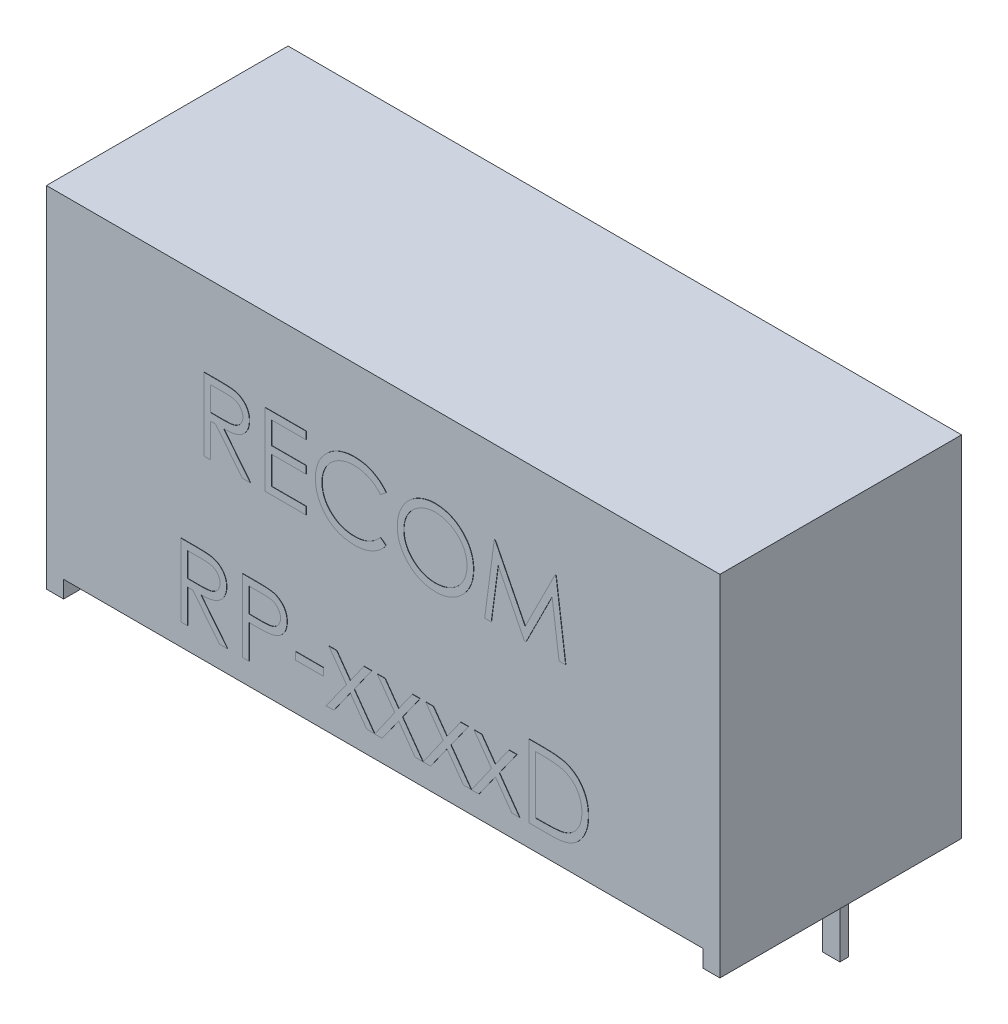
from build123d import *

# Parameters (mm, degrees)
CROQUIS1_W                  = 0.5
CROQUIS1_H                  = 7.05
SALIENTE_EXTRUIR1_DEPTH     = 0.5
SALIENTE_EXTRUIR1_2_DEPTH   = 0.5
CROQUIS2_W                  = 19.65
CROQUIS2_H                  = 7.05
SALIENTE_EXTRUIR2_DEPTH     = 9.7
CROQUIS3_W                  = 0.51
CROQUIS3_H                  = 0.25
SALIENTE_EXTRUIR3_DEPTH     = 4
SALIENTE_EXTRUIR4_OUTLINE_W = 0.814102564
SALIENTE_EXTRUIR4_OUTLINE_H = 0.217094017
SALIENTE_EXTRUIR4_DEPTH     = 0.01


# Read off the part's stored shape, not the designer's step: Saliente-Extruir4
with BuildPart() as part:
    # Croquis1 → Saliente-Extruir1 (new body)
    with BuildSketch(Plane(origin=(0, 0, 0), x_dir=(1, 0, 0), z_dir=(0, 1, 0))):
        with Locations((-9.575, 0)):
            Rectangle(CROQUIS1_W, CROQUIS1_H)
    extrude(amount=SALIENTE_EXTRUIR1_DEPTH)



with BuildPart() as body_2:
    # Croquis1 → Saliente-Extruir1 2 (new body)
    with BuildSketch(Plane(origin=(0, 0, 0), x_dir=(1, 0, 0), z_dir=(0, 1, 0))):
        with Locations((9.575, 0)):
            Rectangle(CROQUIS1_W, CROQUIS1_H)
    extrude(amount=SALIENTE_EXTRUIR1_2_DEPTH)


with BuildPart() as part_1:
    add(part.part)

    add(body_2.part)  # Saliente-Extruir2 merges body 2
    # Croquis2 → Saliente-Extruir2 (add)
    with BuildSketch(Plane(origin=(0, 0.5, 0), x_dir=(1, 0, 0), z_dir=(0, 1, 0))):
        Rectangle(CROQUIS2_W, CROQUIS2_H)
    extrude(amount=SALIENTE_EXTRUIR2_DEPTH)

    # Croquis3 → Saliente-Extruir3 (add)
    with BuildSketch(Plane.XZ.offset(-0.5)):
        with Locations((-7.825, -2.255)):
            Rectangle(CROQUIS3_W, CROQUIS3_H)
        with Locations((-5.285, -2.255)):
            Rectangle(CROQUIS3_W, CROQUIS3_H)
        with Locations((2.335, -2.255)):
            Rectangle(CROQUIS3_W, CROQUIS3_H)
        with Locations((4.875, -2.255)):
            Rectangle(CROQUIS3_W, CROQUIS3_H)
        with Locations((7.415, -2.255)):
            Rectangle(CROQUIS3_W, CROQUIS3_H)
    extrude(amount=SALIENTE_EXTRUIR3_DEPTH)

    # Saliente-Extruir4 outline → Saliente-Extruir4 (add)
    # profile 1 of 13: a face of its own
    with BuildSketch(Plane.XY.offset(3.525)):
        with BuildLine():
            add(Edge.make_bspline(
                [(-3.894123932, 7.2228332), (-3.895012326, 7.194630065), (-3.896745813, 7.139598445), (-3.912908137, 7.059733054), (-3.939382509, 6.98523285), (-3.975863736, 6.916191635), (-4.022321228, 6.853955197), (-4.078155745, 6.799290494), (-4.143398434, 6.753546356), (-4.204134258, 6.721824898), (-4.257785227, 6.701509186), (-4.301952992, 6.687214817), (-4.350132545, 6.676170676), (-4.401862266, 6.666276692), (-4.457357429, 6.658806857), (-4.516485025, 6.653335822), (-4.579287221, 6.649916469), (-4.622430373, 6.649407256), (-4.644624733, 6.649145299)],
                knots=[0, 0, 0, 0, 0.078780236, 0.153720644, 0.22671353, 0.299191166, 0.371189997, 0.443006414, 0.516689173, 0.593217217, 0.633872918, 0.676989142, 0.722899506, 0.771958611, 0.824211323, 0.879378651, 0.937948119, 1, 1, 1, 1], degree=3))
            add(Edge.make_bspline(
                [(-4.320679754, 7.76005609), (-4.305193843, 7.756229903), (-4.274552378, 7.748659153), (-4.230434958, 7.732657394), (-4.188395343, 7.714139812), (-4.148608163, 7.692390324), (-4.111272708, 7.667247481), (-4.076004016, 7.63914533), (-4.042642045, 7.608237639), (-4.012536012, 7.57374514), (-3.984149061, 7.537558298), (-3.960207368, 7.498427931), (-3.939568973, 7.457508817), (-3.92313728, 7.414384807), (-3.909906315, 7.369474116), (-3.900577113, 7.322369939), (-3.894982347, 7.273286873), (-3.894412749, 7.239808519), (-3.894123932, 7.2228332)],
                knots=[0, 0, 0, 0, 0.064216843, 0.127063766, 0.188744538, 0.249132103, 0.309452533, 0.369826676, 0.430650142, 0.492351932, 0.554072106, 0.615689784, 0.676797703, 0.738439048, 0.80131691, 0.865184512, 0.931641324, 1, 1, 1, 1], degree=3))
            add(Edge.make_bspline(
                [(-4.800237046, 7.788888889), (-4.771969792, 7.788794796), (-4.717693533, 7.788614128), (-4.639937317, 7.787606738), (-4.56928474, 7.78471939), (-4.505772742, 7.782234675), (-4.449402488, 7.777703835), (-4.400001127, 7.773373348), (-4.357796186, 7.767704515), (-4.332247504, 7.762439807), (-4.320679754, 7.76005609)],
                knots=[0, 0, 0, 0, 0.176257755, 0.338434414, 0.484822051, 0.617157578, 0.734698361, 0.837385184, 0.926372421, 1, 1, 1, 1], degree=3))
            Line((-4.800237046, 7.788888889), (-5.223824786, 7.788888889))
            Line((-5.223824786, 7.788888889), (-5.223824786, 5.672222222))
            Line((-5.223824786, 5.672222222), (-5.033867521, 5.672222222))
            Line((-5.033867521, 5.672222222), (-5.033867521, 6.649145299))
            Line((-5.033867521, 6.649145299), (-4.879527244, 6.649145299))
            Line((-4.879527244, 6.649145299), (-4.10188969, 5.672222222))
            Line((-4.10188969, 5.672222222), (-3.866987179, 5.672222222))
            Line((-3.866987179, 5.672222222), (-4.644624733, 6.649145299))
        make_face()
        with BuildLine():
            add(Edge.make_bspline(
                [(-4.64632078, 6.863271234), (-4.62822628, 6.863263229), (-4.593153986, 6.863247713), (-4.54241406, 6.865662997), (-4.495169993, 6.868410622), (-4.45160249, 6.872613322), (-4.41169209, 6.878029613), (-4.37545874, 6.884804751), (-4.342843294, 6.892698141), (-4.304804654, 6.904915315), (-4.262328276, 6.924271336), (-4.216165917, 6.952432375), (-4.176854979, 6.987852747), (-4.143642748, 7.028355742), (-4.116954949, 7.07288814), (-4.098139564, 7.120916135), (-4.086200087, 7.171227244), (-4.084791871, 7.205806386), (-4.084081197, 7.223257212)],
                knots=[0, 0, 0, 0, 0.07166815, 0.138913286, 0.20118457, 0.259124428, 0.312255041, 0.36068151, 0.405086143, 0.445101659, 0.51877778, 0.589461579, 0.658462242, 0.727283218, 0.796322487, 0.863174893, 0.930949381, 1, 1, 1, 1], degree=3))
            Line((-4.64632078, 6.863271234), (-5.033867521, 6.866239316))
            Line((-5.033867521, 6.866239316), (-5.033867521, 7.571794872))
            Line((-5.033867521, 7.571794872), (-4.636992521, 7.571794872))
            add(Edge.make_bspline(
                [(-4.084081197, 7.223257212), (-4.084808194, 7.240279187), (-4.086248836, 7.274010531), (-4.098010711, 7.323392915), (-4.117900956, 7.370000071), (-4.144705357, 7.413642402), (-4.177361989, 7.453257776), (-4.21565419, 7.487152959), (-4.25853495, 7.515122873), (-4.298613247, 7.532996237), (-4.334435842, 7.543954434), (-4.365538541, 7.551665852), (-4.400682149, 7.557861316), (-4.440037307, 7.562825239), (-4.483436008, 7.5670918), (-4.531097687, 7.569965495), (-4.582706121, 7.571667213), (-4.618475932, 7.571751329), (-4.636992521, 7.571794872)],
                knots=[0, 0, 0, 0, 0.068814296, 0.136364825, 0.204019354, 0.273063739, 0.34291332, 0.410965444, 0.479168767, 0.549308007, 0.587651576, 0.630646669, 0.678878786, 0.731934299, 0.791111423, 0.85528319, 0.925085939, 1, 1, 1, 1], degree=3))
        make_face(mode=Mode.SUBTRACT)
    # profile 2 of 13: a face of its own
    with BuildSketch(Plane.XY.offset(3.525)):
        with BuildLine():
            add(Edge.make_bspline(
                [(-0.828518964, 7.843162393), (-0.804198783, 7.842870814), (-0.756059435, 7.842293663), (-0.684847116, 7.836665663), (-0.615515804, 7.827283625), (-0.548017734, 7.814513431), (-0.482024533, 7.798664241), (-0.418040578, 7.778017489), (-0.35569042, 7.754409682), (-0.295367289, 7.727220515), (-0.237360614, 7.696700152), (-0.181688459, 7.663186894), (-0.128793045, 7.626722288), (-0.07830217, 7.587616463), (-0.031060461, 7.545042096), (0.014273385, 7.500170216), (0.056159847, 7.451708332), (0.082015351, 7.417596777), (0.094978632, 7.400494124)],
                knots=[0, 0, 0, 0, 0.068547537, 0.135682946, 0.20121499, 0.265682235, 0.329266835, 0.392395428, 0.455069762, 0.51712685, 0.578790035, 0.639739863, 0.700191504, 0.759806243, 0.819628319, 0.879354791, 0.939511608, 1, 1, 1, 1], degree=3))
            add(Edge.make_bspline(
                [(-1.96741453, 6.742851896), (-1.966474008, 6.780924956), (-1.96462359, 6.855831325), (-1.948902323, 6.965761287), (-1.923611909, 7.071081419), (-1.887690933, 7.171595112), (-1.842149125, 7.267831043), (-1.785890173, 7.359054058), (-1.719567663, 7.445847551), (-1.643701753, 7.526894567), (-1.56050627, 7.6010017), (-1.471413463, 7.666198785), (-1.376597714, 7.720456521), (-1.277103585, 7.765811343), (-1.172186054, 7.800672518), (-1.062068969, 7.825076588), (-0.946959244, 7.840266463), (-0.868423396, 7.842186708), (-0.828518964, 7.843162393)],
                knots=[0, 0, 0, 0, 0.064557846, 0.127013532, 0.18795481, 0.248013913, 0.307747682, 0.368234515, 0.429469844, 0.492743437, 0.556257769, 0.618216786, 0.679655476, 0.741245546, 0.803415265, 0.866815462, 0.932328312, 1, 1, 1, 1], degree=3))
            add(Edge.make_bspline(
                [(-1.699015091, 5.988110978), (-1.720445218, 6.01444303), (-1.763046749, 6.066789231), (-1.817551329, 6.151628848), (-1.864207232, 6.240207241), (-1.901929812, 6.33298977), (-1.931419656, 6.429768237), (-1.951849236, 6.530591429), (-1.96512473, 6.635365185), (-1.966642857, 6.706628385), (-1.96741453, 6.742851896)],
                knots=[0, 0, 0, 0, 0.12432851, 0.247156016, 0.368779749, 0.490733862, 0.613613772, 0.738957576, 0.867310575, 1, 1, 1, 1], degree=3))
            add(Edge.make_bspline(
                [(-0.825974893, 5.617948718), (-0.848740349, 5.618107161), (-0.893756219, 5.618420463), (-0.960218797, 5.623495726), (-1.02492202, 5.630420091), (-1.08768096, 5.640846265), (-1.148838097, 5.653149747), (-1.207839022, 5.669642364), (-1.265264316, 5.688117336), (-1.320883265, 5.709831304), (-1.374743179, 5.734333948), (-1.426670341, 5.762026938), (-1.476640869, 5.792677399), (-1.525146052, 5.825609715), (-1.571469353, 5.861881703), (-1.616012199, 5.90098962), (-1.659024363, 5.942801655), (-1.685635511, 5.972951971), (-1.699015091, 5.988110978)],
                knots=[0, 0, 0, 0, 0.069662801, 0.137749562, 0.203916744, 0.268779862, 0.332413706, 0.39475354, 0.456180032, 0.516995649, 0.577395938, 0.637198344, 0.696999184, 0.756756194, 0.816553905, 0.876947997, 0.938131788, 1, 1, 1, 1], degree=3))
            add(Edge.make_bspline(
                [(0.094978632, 6.061889022), (0.081602442, 6.044630054), (0.054914133, 6.010194786), (0.011699046, 5.961649514), (-0.033825795, 5.91598755), (-0.081998534, 5.873577036), (-0.132265008, 5.833569335), (-0.185527788, 5.797101085), (-0.241086679, 5.763663265), (-0.298753435, 5.733046029), (-0.358466786, 5.705881789), (-0.420155183, 5.682626416), (-0.483552721, 5.662593744), (-0.5486623, 5.646112811), (-0.615618972, 5.63324887), (-0.684181116, 5.624649352), (-0.754496707, 5.618757814), (-0.801935091, 5.618220836), (-0.825974893, 5.617948718)],
                knots=[0, 0, 0, 0, 0.061674239, 0.123053062, 0.183475001, 0.243726501, 0.304278917, 0.364862921, 0.425946204, 0.48739123, 0.549220384, 0.611143589, 0.67352853, 0.736961457, 0.800785283, 0.866012596, 0.932100748, 1, 1, 1, 1], degree=3))
            Line((0.094978632, 6.061889022), (-0.071233974, 6.187820513))
            add(Edge.make_bspline(
                [(-0.827246928, 5.835042735), (-0.79029435, 5.836064045), (-0.717562835, 5.838074226), (-0.610902172, 5.855103868), (-0.508796733, 5.882716037), (-0.411241026, 5.921359066), (-0.318510073, 5.971593788), (-0.230458759, 6.032492028), (-0.147012762, 6.104633067), (-0.096834891, 6.159716673), (-0.071233974, 6.187820513)],
                knots=[0, 0, 0, 0, 0.12851519, 0.252948636, 0.374754734, 0.495939754, 0.617180641, 0.740909469, 0.867811148, 1, 1, 1, 1], degree=3))
            add(Edge.make_bspline(
                [(-1.777457265, 6.728435497), (-1.776694165, 6.697150365), (-1.775195919, 6.635726159), (-1.761861927, 6.545755361), (-1.741599324, 6.459564287), (-1.711230856, 6.377691716), (-1.673784573, 6.29912809), (-1.626467632, 6.225202688), (-1.571666202, 6.154798385), (-1.508605005, 6.089579078), (-1.439416726, 6.03000173), (-1.365183465, 5.977538283), (-1.28609011, 5.933804997), (-1.203009958, 5.897412877), (-1.115303689, 5.86943857), (-1.023129023, 5.849745029), (-0.926686435, 5.836898567), (-0.860785893, 5.83566867), (-0.827246928, 5.835042735)],
                knots=[0, 0, 0, 0, 0.064323217, 0.126290104, 0.186726469, 0.246146432, 0.305575643, 0.365429386, 0.426326309, 0.488839906, 0.551724972, 0.613918596, 0.675483766, 0.737333897, 0.800229044, 0.864502298, 0.931040739, 1, 1, 1, 1], degree=3))
            add(Edge.make_bspline(
                [(-0.840391293, 7.626068376), (-0.861608336, 7.625824075), (-0.903845507, 7.62533774), (-0.966528156, 7.618921745), (-1.028040334, 7.609904013), (-1.08834203, 7.596523461), (-1.147356486, 7.579606686), (-1.20546951, 7.559392269), (-1.26183973, 7.534382438), (-1.317246951, 7.506739823), (-1.370332473, 7.475517512), (-1.420561002, 7.441461342), (-1.467749345, 7.404952412), (-1.511934829, 7.365853886), (-1.553162627, 7.324341843), (-1.591134, 7.279973884), (-1.625717558, 7.232891855), (-1.657598806, 7.183716604), (-1.686151269, 7.132591368), (-1.710057434, 7.079326921), (-1.731227198, 7.024835392), (-1.747978645, 6.968501118), (-1.761237758, 6.910720493), (-1.770386392, 6.851338445), (-1.77672942, 6.790479029), (-1.777213337, 6.749228636), (-1.777457265, 6.728435497)],
                knots=[0, 0, 0, 0, 0.043954909, 0.087501875, 0.130462627, 0.172752021, 0.215403067, 0.25764983, 0.300152749, 0.34312149, 0.385925163, 0.427685727, 0.46881795, 0.5094918, 0.549883031, 0.589980023, 0.63040523, 0.670868626, 0.711383944, 0.751627258, 0.791775577, 0.832458919, 0.873319045, 0.914542956, 0.956923558, 1, 1, 1, 1], degree=3))
            add(Edge.make_bspline(
                [(-0.071233974, 7.273290598), (-0.083090869, 7.287421447), (-0.106644801, 7.315492629), (-0.1445387, 7.354910735), (-0.184030645, 7.391840678), (-0.225105543, 7.426458387), (-0.268502724, 7.457553288), (-0.313170922, 7.486745812), (-0.359857359, 7.512912491), (-0.424416741, 7.544640107), (-0.50887044, 7.577748496), (-0.615184461, 7.605509021), (-0.726164983, 7.623180875), (-0.801879722, 7.625094851), (-0.840391293, 7.626068376)],
                knots=[0, 0, 0, 0, 0.063163259, 0.125474941, 0.18712122, 0.248294346, 0.309294856, 0.369850066, 0.430973376, 0.49245599, 0.616147966, 0.740843698, 0.868182649, 1, 1, 1, 1], degree=3))
            Line((-0.071233974, 7.273290598), (0.094978632, 7.400494124))
        make_face()
    # profile 3 of 13: a face of its own
    with BuildSketch(Plane.XY.offset(3.525)):
        with BuildLine():
            add(Edge.make_bspline(
                [(0.420619658, 6.721227297), (0.420942985, 6.746405149), (0.421585561, 6.796443224), (0.429321489, 6.870748263), (0.440546899, 6.943858328), (0.456634722, 7.01556552), (0.477675397, 7.085694306), (0.502502099, 7.154728339), (0.532824768, 7.221968019), (0.567103064, 7.28773188), (0.605361396, 7.350994756), (0.647619587, 7.410793361), (0.692393358, 7.467629488), (0.741477886, 7.520030295), (0.793255451, 7.569520173), (0.848565994, 7.615338578), (0.907072018, 7.657898667), (0.969025266, 7.696252874), (1.032899175, 7.730941493), (1.098743703, 7.760708994), (1.165664582, 7.786257802), (1.23397525, 7.806965349), (1.303494307, 7.823313294), (1.374373482, 7.834445361), (1.446556306, 7.84220102), (1.495186009, 7.842840557), (1.51965812, 7.843162393)],
                knots=[0, 0, 0, 0, 0.043208986, 0.085872872, 0.128120007, 0.170151964, 0.211917621, 0.253753003, 0.296006409, 0.338443357, 0.381015368, 0.422820479, 0.464089056, 0.505125849, 0.545974971, 0.586985211, 0.628338592, 0.670083802, 0.711991602, 0.753039155, 0.794049395, 0.834885543, 0.875498313, 0.9165473, 0.958003779, 1, 1, 1, 1], degree=3))
            add(Edge.make_bspline(
                [(1.53661859, 5.617948718), (1.498261978, 5.618885728), (1.422650885, 5.620732825), (1.311654678, 5.636566341), (1.205048614, 5.661326082), (1.103137554, 5.69671036), (1.005864668, 5.74244078), (0.913039713, 5.798202476), (0.825035277, 5.864367747), (0.742580982, 5.939458961), (0.66713742, 6.021205567), (0.601363892, 6.108795807), (0.545589657, 6.200511249), (0.500012785, 6.296606419), (0.463929993, 6.396616767), (0.439313269, 6.501209418), (0.423386289, 6.609788072), (0.421550929, 6.68371592), (0.420619658, 6.721227297)],
                knots=[0, 0, 0, 0, 0.065818877, 0.129746527, 0.192071954, 0.253459424, 0.314569588, 0.376279881, 0.439025654, 0.503267029, 0.567492823, 0.629704796, 0.690999649, 0.751451651, 0.812004364, 0.873149681, 0.935635484, 1, 1, 1, 1], degree=3))
            add(Edge.make_bspline(
                [(2.645833333, 6.731403579), (2.644895993, 6.693329314), (2.643048387, 6.618280526), (2.627222507, 6.50812711), (2.602402474, 6.402238927), (2.566965685, 6.300792746), (2.521472181, 6.203681553), (2.465437863, 6.111160871), (2.399433417, 6.02320037), (2.324317845, 5.940763663), (2.242432453, 5.865169955), (2.15460272, 5.799299968), (2.062803903, 5.742619188), (1.965854698, 5.697392871), (1.865040866, 5.66124509), (1.759460128, 5.636599452), (1.649607212, 5.62070205), (1.574694748, 5.618876566), (1.53661859, 5.617948718)],
                knots=[0, 0, 0, 0, 0.065226504, 0.128568996, 0.190320378, 0.251377989, 0.312387528, 0.373788704, 0.43643116, 0.500566755, 0.564686795, 0.627135518, 0.688455409, 0.749245746, 0.810155177, 0.871670926, 0.934773496, 1, 1, 1, 1], degree=3))
            add(Edge.make_bspline(
                [(1.51965812, 7.843162393), (1.558851593, 7.842169689), (1.635830809, 7.840219936), (1.74896658, 7.825294954), (1.85697409, 7.799474409), (1.960733174, 7.765085843), (2.059002736, 7.719212001), (2.152522448, 7.663764316), (2.241069795, 7.598161886), (2.323451297, 7.52291183), (2.398839072, 7.441037074), (2.465257584, 7.353662338), (2.520921257, 7.26131592), (2.566632662, 7.164275322), (2.602494202, 7.062760008), (2.627240481, 6.956228778), (2.643047838, 6.845371875), (2.644895856, 6.76976039), (2.645833333, 6.731403579)],
                knots=[0, 0, 0, 0, 0.066570035, 0.130749041, 0.1934128, 0.254989399, 0.316113556, 0.377261758, 0.439400784, 0.502970589, 0.566524976, 0.628231103, 0.689090611, 0.749344669, 0.810169593, 0.871609824, 0.934869184, 1, 1, 1, 1], degree=3))
        make_face()
        with BuildLine():
            add(Edge.make_bspline(
                [(2.455876068, 6.731827591), (2.455633491, 6.752338396), (2.455152293, 6.793025356), (2.448776606, 6.85317547), (2.439644162, 6.911990507), (2.426482906, 6.969239569), (2.409519241, 7.024937248), (2.388602141, 7.079031234), (2.363936746, 7.131723047), (2.335628915, 7.182882455), (2.303808869, 7.231973844), (2.269038541, 7.278904827), (2.230717593, 7.322794056), (2.189940902, 7.364725038), (2.145689938, 7.403803476), (2.09816515, 7.440042334), (2.047943497, 7.474316171), (1.994768455, 7.505234963), (1.939889969, 7.533788333), (1.883578194, 7.558251558), (1.826471072, 7.579038507), (1.768713823, 7.59676829), (1.709820308, 7.609715051), (1.650188468, 7.618924396), (1.589900807, 7.625333896), (1.549355622, 7.625822772), (1.528986378, 7.626068376)],
                knots=[0, 0, 0, 0, 0.042915082, 0.085129971, 0.126473319, 0.167453038, 0.207976333, 0.248249378, 0.288749987, 0.329669857, 0.370537287, 0.411128564, 0.451818913, 0.492405877, 0.533485862, 0.575263062, 0.617440613, 0.660671688, 0.703940204, 0.746867522, 0.7890793, 0.831104042, 0.87323799, 0.91516577, 0.957380658, 1, 1, 1, 1], degree=3))
            add(Edge.make_bspline(
                [(1.528986378, 5.835042735), (1.549916886, 5.835330302), (1.59142837, 5.835900634), (1.653171853, 5.841645071), (1.71380299, 5.850856726), (1.773236741, 5.864119551), (1.83140565, 5.880718576), (1.888552507, 5.900438487), (1.944068616, 5.92504093), (1.998654328, 5.952223738), (2.050903483, 5.983211834), (2.100781543, 6.01649681), (2.147031303, 6.053368309), (2.190809455, 6.092265272), (2.231708105, 6.13397198), (2.269450682, 6.178434209), (2.303910095, 6.225932607), (2.335639319, 6.275695685), (2.36394415, 6.327702943), (2.388605795, 6.38124232), (2.409528208, 6.436181981), (2.426418304, 6.49260117), (2.439653797, 6.550392731), (2.448773558, 6.609634044), (2.455152852, 6.670206599), (2.455633685, 6.711175503), (2.455876068, 6.731827591)],
                knots=[0, 0, 0, 0, 0.043633218, 0.086537777, 0.129177336, 0.171436324, 0.213415895, 0.255265955, 0.297369481, 0.339940748, 0.382347459, 0.423952947, 0.464871163, 0.505572294, 0.546002577, 0.586567975, 0.627064799, 0.668270684, 0.709549225, 0.750428154, 0.791096194, 0.832027145, 0.873135955, 0.914610764, 0.956955986, 1, 1, 1, 1], degree=3))
            add(Edge.make_bspline(
                [(0.610576923, 6.722075321), (0.611347911, 6.691497216), (0.612864683, 6.631340623), (0.626143785, 6.543185603), (0.646598026, 6.458465544), (0.676749862, 6.377644009), (0.714457139, 6.300026276), (0.761040068, 6.226300898), (0.816230086, 6.15644795), (0.878921838, 6.090955097), (0.947455094, 6.03117692), (1.020227745, 5.978705716), (1.096460165, 5.934309993), (1.176351149, 5.898142164), (1.259474185, 5.869482656), (1.346364894, 5.849840817), (1.436444458, 5.836913756), (1.49784633, 5.835672327), (1.528986378, 5.835042735)],
                knots=[0, 0, 0, 0, 0.064503999, 0.126899322, 0.18774654, 0.248149733, 0.308586065, 0.369583005, 0.431826965, 0.496179723, 0.560667855, 0.623504455, 0.685260411, 0.746536822, 0.808327352, 0.870486188, 0.934316883, 1, 1, 1, 1], degree=3))
            add(Edge.make_bspline(
                [(1.528986378, 7.626068376), (1.508899433, 7.625823514), (1.468917576, 7.62533613), (1.409478832, 7.61891615), (1.350821806, 7.60976617), (1.292934382, 7.596714488), (1.236058769, 7.578932037), (1.179664817, 7.558466345), (1.12426678, 7.5335374), (1.070047542, 7.505372002), (1.017484616, 7.474197179), (0.967886458, 7.439742824), (0.921124669, 7.402816937), (0.877313741, 7.36333334), (0.836582317, 7.321090962), (0.798128712, 7.276730203), (0.763494251, 7.228983107), (0.731752974, 7.179144432), (0.703348613, 7.127279095), (0.678090518, 7.07393313), (0.657429427, 7.018671387), (0.640579323, 6.962093396), (0.626609437, 6.904288766), (0.617759397, 6.84481899), (0.611268875, 6.783982899), (0.61080935, 6.742870063), (0.610576923, 6.722075321)],
                knots=[0, 0, 0, 0, 0.042023329, 0.083644911, 0.124983795, 0.166247461, 0.207701556, 0.249631071, 0.29174177, 0.334742875, 0.377460169, 0.419556319, 0.461044176, 0.502096284, 0.542890714, 0.583800819, 0.624863583, 0.666224689, 0.707399186, 0.748556678, 0.789654591, 0.830739726, 0.872070142, 0.913993395, 0.95649813, 1, 1, 1, 1], degree=3))
        make_face(mode=Mode.SUBTRACT)
    # profile 4 of 13: a face of its own
    with BuildSketch(Plane.XY.offset(3.525)):
        with BuildLine():
            add(Edge.make_bspline(
                [(-4.558974359, 2.695055422), (-4.559862753, 2.666852287), (-4.56159624, 2.611820667), (-4.577758565, 2.531955277), (-4.604232936, 2.457455072), (-4.640714163, 2.388413858), (-4.687171656, 2.32617742), (-4.743006172, 2.271512716), (-4.808248861, 2.225768578), (-4.868984686, 2.19404712), (-4.922635654, 2.173731409), (-4.966803419, 2.159437039), (-5.014982972, 2.148392898), (-5.066712694, 2.138498914), (-5.122207857, 2.13102908), (-5.181335452, 2.125558044), (-5.244137649, 2.122138691), (-5.2872808, 2.121629478), (-5.30947516, 2.121367521)],
                knots=[0, 0, 0, 0, 0.078780236, 0.153720644, 0.22671353, 0.299191166, 0.371189997, 0.443006414, 0.516689173, 0.593217217, 0.633872918, 0.676989142, 0.722899506, 0.771958611, 0.824211323, 0.879378651, 0.937948119, 1, 1, 1, 1], degree=3))
            add(Edge.make_bspline(
                [(-4.985530182, 3.232278312), (-4.970044271, 3.228452125), (-4.939402806, 3.220881375), (-4.895285385, 3.204879616), (-4.85324577, 3.186362034), (-4.81345859, 3.164612546), (-4.776123136, 3.139469703), (-4.740854443, 3.111367553), (-4.707492472, 3.080459861), (-4.677386439, 3.045967362), (-4.648999489, 3.009780521), (-4.625057795, 2.970650153), (-4.604419401, 2.929731039), (-4.587987707, 2.886607029), (-4.574756742, 2.841696339), (-4.56542754, 2.794592162), (-4.559832774, 2.745509096), (-4.559263176, 2.712030741), (-4.558974359, 2.695055422)],
                knots=[0, 0, 0, 0, 0.064216843, 0.127063766, 0.188744538, 0.249132103, 0.309452533, 0.369826676, 0.430650142, 0.492351932, 0.554072106, 0.615689784, 0.676797703, 0.738439048, 0.80131691, 0.865184512, 0.931641324, 1, 1, 1, 1], degree=3))
            add(Edge.make_bspline(
                [(-5.465087473, 3.261111111), (-5.436820219, 3.261017019), (-5.382543961, 3.260836351), (-5.304787745, 3.259828961), (-5.234135167, 3.256941612), (-5.170623169, 3.254456897), (-5.114252916, 3.249926057), (-5.064851554, 3.24559557), (-5.022646613, 3.239926737), (-4.997097932, 3.234662029), (-4.985530182, 3.232278312)],
                knots=[0, 0, 0, 0, 0.176257755, 0.338434414, 0.484822051, 0.617157578, 0.734698361, 0.837385184, 0.926372421, 1, 1, 1, 1], degree=3))
            Line((-5.465087473, 3.261111111), (-5.888675214, 3.261111111))
            Line((-5.888675214, 3.261111111), (-5.888675214, 1.144444444))
            Line((-5.888675214, 1.144444444), (-5.698717949, 1.144444444))
            Line((-5.698717949, 1.144444444), (-5.698717949, 2.121367521))
            Line((-5.698717949, 2.121367521), (-5.544377671, 2.121367521))
            Line((-5.544377671, 2.121367521), (-4.766740118, 1.144444444))
            Line((-4.766740118, 1.144444444), (-4.531837607, 1.144444444))
            Line((-4.531837607, 1.144444444), (-5.30947516, 2.121367521))
        make_face()
        with BuildLine():
            add(Edge.make_bspline(
                [(-5.311171207, 2.335493456), (-5.293076708, 2.335485451), (-5.258004413, 2.335469935), (-5.207264488, 2.337885219), (-5.16002042, 2.340632845), (-5.116452918, 2.344835544), (-5.076542517, 2.350251835), (-5.040309167, 2.357026973), (-5.007693722, 2.364920363), (-4.969655082, 2.377137537), (-4.927178703, 2.396493558), (-4.881016344, 2.424654597), (-4.841705407, 2.46007497), (-4.808493176, 2.500577964), (-4.781805377, 2.545110362), (-4.762989991, 2.593138357), (-4.751050514, 2.643449466), (-4.749642299, 2.678028608), (-4.748931624, 2.695479434)],
                knots=[0, 0, 0, 0, 0.07166815, 0.138913286, 0.20118457, 0.259124428, 0.312255041, 0.36068151, 0.405086143, 0.445101659, 0.51877778, 0.589461579, 0.658462242, 0.727283218, 0.796322487, 0.863174893, 0.930949381, 1, 1, 1, 1], degree=3))
            Line((-5.311171207, 2.335493456), (-5.698717949, 2.338461538))
            Line((-5.698717949, 2.338461538), (-5.698717949, 3.044017094))
            Line((-5.698717949, 3.044017094), (-5.301842949, 3.044017094))
            add(Edge.make_bspline(
                [(-4.748931624, 2.695479434), (-4.749658621, 2.712501409), (-4.751099264, 2.746232754), (-4.762861138, 2.795615137), (-4.782751383, 2.842222293), (-4.809555784, 2.885864624), (-4.842212416, 2.925479998), (-4.880504617, 2.959375181), (-4.923385378, 2.987345095), (-4.963463674, 3.005218459), (-4.999286269, 3.016176656), (-5.030388968, 3.023888074), (-5.065532576, 3.030083538), (-5.104887735, 3.035047461), (-5.148286435, 3.039314023), (-5.195948115, 3.042187717), (-5.247556548, 3.043889435), (-5.283326359, 3.043973551), (-5.301842949, 3.044017094)],
                knots=[0, 0, 0, 0, 0.068814296, 0.136364825, 0.204019354, 0.273063739, 0.34291332, 0.410965444, 0.479168767, 0.549308007, 0.587651576, 0.630646669, 0.678878786, 0.731934299, 0.791111423, 0.85528319, 0.925085939, 1, 1, 1, 1], degree=3))
        make_face(mode=Mode.SUBTRACT)
    # profile 5 of 13: a face of its own
    with BuildSketch(Plane.XY.offset(3.525)):
        with BuildLine():
            add(Edge.make_bspline(
                [(-3.217401175, 2.156136485), (-3.230661991, 2.153316492), (-3.259723841, 2.147136312), (-3.307586345, 2.140236912), (-3.363312364, 2.134347982), (-3.426825838, 2.129932533), (-3.498069757, 2.126152548), (-3.57708266, 2.123148034), (-3.664019649, 2.121497122), (-3.724659878, 2.121411976), (-3.756320112, 2.121367521)],
                knots=[0, 0, 0, 0, 0.075173117, 0.164746258, 0.268016881, 0.385911876, 0.517789479, 0.663690977, 0.824413221, 1, 1, 1, 1], degree=3))
            add(Edge.make_bspline(
                [(-2.79508547, 2.693359375), (-2.795340332, 2.675955672), (-2.795838986, 2.641904151), (-2.801823882, 2.592088227), (-2.809885474, 2.544482343), (-2.822281311, 2.499192057), (-2.838516551, 2.456486329), (-2.857561745, 2.415712536), (-2.880532737, 2.377564354), (-2.906927467, 2.341903287), (-2.936289622, 2.308695864), (-2.96849497, 2.278182727), (-3.003413495, 2.250542484), (-3.040934222, 2.225713171), (-3.081422941, 2.204270564), (-3.124265576, 2.185064956), (-3.169834517, 2.168935314), (-3.201368323, 2.160450468), (-3.217401175, 2.156136485)],
                knots=[0, 0, 0, 0, 0.070118894, 0.137192353, 0.202016181, 0.264631407, 0.326116547, 0.386010305, 0.445811847, 0.505297697, 0.564633278, 0.624282625, 0.683902032, 0.743952771, 0.805387731, 0.868388031, 0.933084028, 1, 1, 1, 1], degree=3))
            add(Edge.make_bspline(
                [(-3.200440705, 3.22931023), (-3.185809378, 3.225305527), (-3.156891491, 3.217390487), (-3.115222765, 3.201537425), (-3.075578297, 3.182740116), (-3.037822069, 3.161317066), (-3.002418047, 3.13634913), (-2.968838013, 3.108848418), (-2.93737831, 3.078179994), (-2.908215849, 3.044687832), (-2.881434091, 3.008934181), (-2.858374711, 2.970385309), (-2.839066341, 2.929690092), (-2.822505981, 2.886876837), (-2.810587059, 2.841586022), (-2.80160822, 2.794132344), (-2.795909169, 2.744520888), (-2.795363334, 2.710618016), (-2.79508547, 2.693359375)],
                knots=[0, 0, 0, 0, 0.062481339, 0.123490383, 0.183411094, 0.243153221, 0.302126735, 0.361709671, 0.421842292, 0.482931901, 0.544552254, 0.60568072, 0.667679738, 0.729984388, 0.794550921, 0.86034562, 0.928907356, 1, 1, 1, 1], degree=3))
            add(Edge.make_bspline(
                [(-3.682542067, 3.261111111), (-3.65399071, 3.261079726), (-3.599285041, 3.261019591), (-3.520838317, 3.259196388), (-3.449591479, 3.256761198), (-3.385698153, 3.253385482), (-3.328961751, 3.249396115), (-3.279639003, 3.243800834), (-3.237342224, 3.237958655), (-3.2119988, 3.232019043), (-3.200440705, 3.22931023)],
                knots=[0, 0, 0, 0, 0.176955752, 0.33905508, 0.486318225, 0.618780923, 0.735618828, 0.838742477, 0.926457068, 1, 1, 1, 1], degree=3))
            Line((-3.682542067, 3.261111111), (-4.097649573, 3.261111111))
            Line((-4.097649573, 3.261111111), (-4.097649573, 1.144444444))
            Line((-4.097649573, 1.144444444), (-3.907692308, 1.144444444))
            Line((-3.907692308, 1.144444444), (-3.907692308, 2.121367521))
            Line((-3.907692308, 2.121367521), (-3.756320112, 2.121367521))
        make_face()
        with BuildLine():
            add(Edge.make_bspline(
                [(-3.537106036, 2.333797409), (-3.519011605, 2.333788057), (-3.484080678, 2.333770004), (-3.433621629, 2.336180115), (-3.386807441, 2.338962342), (-3.343781912, 2.343035972), (-3.304525647, 2.348794066), (-3.268973189, 2.354606879), (-3.237400213, 2.363016312), (-3.200449744, 2.374339311), (-3.159275529, 2.393650941), (-3.114482297, 2.421681589), (-3.076521038, 2.45741135), (-3.043671401, 2.497584372), (-3.017602608, 2.54227575), (-2.998518746, 2.590093631), (-2.98730576, 2.640547616), (-2.985802205, 2.675072348), (-2.985042735, 2.692511351)],
                knots=[0, 0, 0, 0, 0.072538371, 0.140033831, 0.202495681, 0.260575056, 0.313228338, 0.361583194, 0.404878361, 0.444127437, 0.516399693, 0.586506671, 0.655085374, 0.724383783, 0.793973529, 0.861637682, 0.930110942, 1, 1, 1, 1], degree=3))
            Line((-3.537106036, 2.333797409), (-3.907692308, 2.338461538))
            Line((-3.907692308, 2.338461538), (-3.907692308, 3.044017094))
            Line((-3.907692308, 3.044017094), (-3.520569578, 3.044017094))
            add(Edge.make_bspline(
                [(-2.985042735, 2.692511351), (-2.985806336, 2.709528452), (-2.987324279, 2.743356343), (-2.998606634, 2.792933975), (-3.017565505, 2.840247948), (-3.043846398, 2.88437929), (-3.075742224, 2.924407757), (-3.112813732, 2.959179829), (-3.154973656, 2.987132954), (-3.194191396, 3.005174987), (-3.229026399, 3.016190891), (-3.259283822, 3.023898485), (-3.29344723, 3.030052304), (-3.331527744, 3.035035242), (-3.373230211, 3.039300906), (-3.418912906, 3.042195283), (-3.468402776, 3.043889497), (-3.502759645, 3.043973532), (-3.520569578, 3.044017094)],
                knots=[0, 0, 0, 0, 0.070043755, 0.139238317, 0.208197455, 0.279173374, 0.349986812, 0.418353846, 0.487609584, 0.557411073, 0.595330157, 0.637964052, 0.685912778, 0.738185165, 0.796102647, 0.858516544, 0.926657726, 1, 1, 1, 1], degree=3))
        make_face(mode=Mode.SUBTRACT)
    # profile 6 of 13: a face of its own
    with BuildSketch(Plane.XY.offset(3.525)):
        with BuildLine():
            add(Edge.make_bspline(
                [(5.997222222, 2.176065037), (5.996841847, 2.149902288), (5.996092277, 2.098345859), (5.989361691, 2.022363032), (5.979578868, 1.948634348), (5.964433092, 1.877510901), (5.94604681, 1.80836955), (5.922482775, 1.741947193), (5.895488928, 1.677634508), (5.864011144, 1.616301082), (5.829454211, 1.558193519), (5.792369157, 1.50341689), (5.752795536, 1.452752827), (5.710355987, 1.406047905), (5.665598939, 1.363372531), (5.618231368, 1.324370217), (5.568131047, 1.28980411), (5.515522372, 1.258315906), (5.458870617, 1.230847406), (5.397102736, 1.2076064), (5.32995531, 1.18834678), (5.257593155, 1.172277715), (5.179891242, 1.159530965), (5.096773391, 1.150987861), (5.008367307, 1.145210611), (4.947661751, 1.144704792), (4.916416266, 1.144444444)],
                knots=[0, 0, 0, 0, 0.046080683, 0.0908068, 0.134295271, 0.177024386, 0.218822734, 0.260244116, 0.301079867, 0.341613894, 0.381583419, 0.420119591, 0.458074619, 0.494738488, 0.531194623, 0.566933698, 0.602712651, 0.638326606, 0.674853249, 0.713467371, 0.754441804, 0.797815361, 0.843989456, 0.89307157, 0.944963346, 1, 1, 1, 1], degree=3))
            add(Edge.make_bspline(
                [(5.359508547, 3.184788996), (5.383998223, 3.175457093), (5.432422229, 3.157004904), (5.501369394, 3.122197045), (5.566275685, 3.082758645), (5.627489168, 3.038637719), (5.683611572, 2.988584994), (5.736835396, 2.934726661), (5.784983348, 2.875104189), (5.829075508, 2.810954077), (5.86882993, 2.743032026), (5.903385516, 2.671467461), (5.932083884, 2.596623816), (5.955907406, 2.518709226), (5.974683121, 2.437552369), (5.987493147, 2.353058745), (5.995942269, 2.265562283), (5.996791386, 2.206190108), (5.997222222, 2.176065037)],
                knots=[0, 0, 0, 0, 0.061544966, 0.121694296, 0.181154855, 0.239875389, 0.298701942, 0.357647424, 0.417604843, 0.478494041, 0.540407051, 0.602344994, 0.665004328, 0.728559309, 0.793650542, 0.860534268, 0.929235961, 1, 1, 1, 1], degree=3))
            add(Edge.make_bspline(
                [(4.687873932, 3.261111111), (4.725048034, 3.260843462), (4.796868206, 3.260326364), (4.900652877, 3.257047713), (4.996679248, 3.251247765), (5.0846315, 3.242799528), (5.164751091, 3.232426027), (5.236813677, 3.219423401), (5.301191878, 3.204069603), (5.340785302, 3.190979259), (5.359508547, 3.184788996)],
                knots=[0, 0, 0, 0, 0.164289216, 0.317405911, 0.458843612, 0.589366542, 0.707831319, 0.815770031, 0.912879903, 1, 1, 1, 1], degree=3))
            Line((4.687873932, 3.261111111), (4.260470085, 3.261111111))
            Line((4.260470085, 3.261111111), (4.260470085, 1.144444444))
            Line((4.260470085, 1.144444444), (4.916416266, 1.144444444))
        make_face()
        with BuildLine():
            add(Edge.make_bspline(
                [(4.693386084, 1.361538462), (4.728298004, 1.361688501), (4.795446411, 1.361977081), (4.892001485, 1.364509342), (4.980223787, 1.368647085), (5.060125842, 1.374437728), (5.131662538, 1.382099223), (5.194983377, 1.390641427), (5.249880795, 1.401283694), (5.283100026, 1.410930227), (5.298450855, 1.415387954)],
                knots=[0, 0, 0, 0, 0.171900665, 0.330627932, 0.475548836, 0.60674619, 0.725023803, 0.829742387, 0.92132282, 1, 1, 1, 1], degree=3))
            Line((4.693386084, 1.361538462), (4.45042735, 1.361538462))
            Line((4.45042735, 1.361538462), (4.45042735, 3.044017094))
            Line((4.45042735, 3.044017094), (4.599255475, 3.044017094))
            add(Edge.make_bspline(
                [(5.249689503, 2.984655449), (5.231939048, 2.989563955), (5.19419671, 3.000000786), (5.132608082, 3.011385655), (5.063293206, 3.021427423), (4.985944339, 3.02992919), (4.900649652, 3.036029617), (4.807343545, 3.04060846), (4.705985689, 3.043696757), (4.635722919, 3.043907642), (4.599255475, 3.044017094)],
                knots=[0, 0, 0, 0, 0.084318617, 0.179284514, 0.286582528, 0.405111483, 0.535592873, 0.67819021, 0.83297584, 1, 1, 1, 1], degree=3))
            add(Edge.make_bspline(
                [(5.807264957, 2.176489049), (5.806954541, 2.201244059), (5.806344724, 2.249875494), (5.798679784, 2.321231772), (5.787478653, 2.389860546), (5.7712809, 2.455766407), (5.750639845, 2.519077934), (5.724880228, 2.579444971), (5.695448511, 2.637505059), (5.660430778, 2.691918128), (5.622079443, 2.743379198), (5.579517583, 2.790523362), (5.533421398, 2.83345801), (5.484293656, 2.872851785), (5.430749791, 2.907119817), (5.37405113, 2.937773191), (5.313365891, 2.963787563), (5.271145832, 2.977623828), (5.249689503, 2.984655449)],
                knots=[0, 0, 0, 0, 0.070151176, 0.137812606, 0.203226247, 0.267174055, 0.330024003, 0.391794272, 0.453084399, 0.514333908, 0.574999993, 0.634865483, 0.694116315, 0.753441622, 0.8131258, 0.874079686, 0.936007013, 1, 1, 1, 1], degree=3))
            add(Edge.make_bspline(
                [(5.298450855, 1.415387954), (5.317772007, 1.422192468), (5.355952826, 1.43563897), (5.410914244, 1.460166698), (5.462172052, 1.489220712), (5.510619544, 1.521516373), (5.555569473, 1.558192764), (5.597554534, 1.598452362), (5.636490195, 1.64250006), (5.671974181, 1.690281186), (5.703729203, 1.741498348), (5.73122847, 1.795648024), (5.755329159, 1.852136904), (5.77424526, 1.911832443), (5.789071351, 1.974200969), (5.799572853, 2.039246869), (5.806113186, 2.106957997), (5.806876062, 2.153011901), (5.807264957, 2.176489049)],
                knots=[0, 0, 0, 0, 0.0624145, 0.123338231, 0.183124538, 0.241782995, 0.300578883, 0.359680075, 0.418881641, 0.479530664, 0.540850536, 0.602303396, 0.664463212, 0.727805723, 0.792894815, 0.859672328, 0.928464401, 1, 1, 1, 1], degree=3))
        make_face(mode=Mode.SUBTRACT)
    # profile 7 of 13: a face of its own
    with BuildSketch(Plane.XY.offset(3.525)):
        Polygon((-3.432799145, 7.788888889), (-3.432799145, 5.672222222), (-2.238782051, 5.672222222), (-2.238782051, 5.889316239), (-3.24284188, 5.889316239), (-3.24284188, 6.703418803), (-2.238782051, 6.703418803), (-2.238782051, 6.920512821), (-3.24284188, 6.920512821), (-3.24284188, 7.571794872), (-2.238782051, 7.571794872), (-2.238782051, 7.788888889), align=None)
    # profile 8 of 13: a face of its own
    with BuildSketch(Plane.XY.offset(3.525)):
        Polygon((3.250898104, 7.788888889), (2.971474359, 5.672222222), (3.162703659, 5.672222222), (3.364957265, 7.19866453), (4.131994525, 5.672222222), (4.174819712, 5.672222222), (4.938888889, 7.195272436), (5.141566506, 5.672222222), (5.332371795, 5.672222222), (5.051252003, 7.788888889), (5.023691239, 7.788888889), (4.151923077, 6.052136752), (3.278034856, 7.788888889), align=None)
    # profile 9 of 13: a face of its own
    with BuildSketch(Plane.XY.offset(3.525)):
        Polygon((-1.062573451, 1.975083467), (-1.65534188, 1.144444444), (-1.429343616, 1.144444444), (-0.949786325, 1.816503072), (-0.470229033, 1.144444444), (-0.244230769, 1.144444444), (-0.836575187, 1.975083467), (-0.325641026, 2.691239316), (-0.55163929, 2.691239316), (-0.949786325, 2.13323985), (-1.34793336, 2.691239316), (-1.573931624, 2.691239316), align=None)
    # profile 10 of 13: a face of its own
    with BuildSketch(Plane.XY.offset(3.525)):
        Polygon((0.461324786, 1.816503072), (0.940882078, 1.144444444), (1.166880342, 1.144444444), (0.574535924, 1.975083467), (1.085470085, 2.691239316), (0.859471822, 2.691239316), (0.461324786, 2.13323985), (0.063177751, 2.691239316), (-0.162820513, 2.691239316), (0.34853766, 1.975083467), (-0.238424679, 1.136302619), (-0.018232505, 1.144444444), align=None)
    # profile 11 of 13: a face of its own
    with BuildSketch(Plane.XY.offset(3.525)):
        Polygon((1.872435897, 1.816503072), (2.351993189, 1.144444444), (2.577991453, 1.144444444), (1.985647035, 1.975083467), (2.496581197, 2.691239316), (2.270582933, 2.691239316), (1.872435897, 2.13323985), (1.474288862, 2.691239316), (1.248290598, 2.691239316), (1.759648771, 1.975083467), (1.172686432, 1.136302619), (1.392878606, 1.144444444), align=None)
    # profile 12 of 13: a face of its own
    with BuildSketch(Plane.XY.offset(3.525)):
        Polygon((3.283547009, 1.816503072), (3.7631043, 1.144444444), (3.989102564, 1.144444444), (3.396758146, 1.975083467), (3.907692308, 2.691239316), (3.681694044, 2.691239316), (3.283547009, 2.13323985), (2.885399973, 2.691239316), (2.659401709, 2.691239316), (3.170759882, 1.975083467), (2.583797543, 1.136302619), (2.803989717, 1.144444444), align=None)
    # profile 13 of 13: a face of its own
    with BuildSketch(Plane.XY.offset(3.525)):
        with Locations((-2.143803419, 1.958547009)):
            Rectangle(SALIENTE_EXTRUIR4_OUTLINE_W, SALIENTE_EXTRUIR4_OUTLINE_H)
    extrude(amount=SALIENTE_EXTRUIR4_DEPTH)


solid = part_1.part
